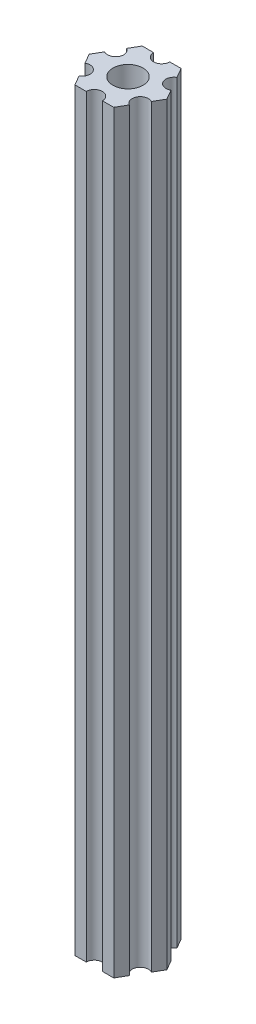
from build123d import *

# Parameters (mm, degrees)
ESBO_O1_R                = 2.79
RESSALTO_EXTRUS_O1_DEPTH = 140


with BuildPart() as part:
    # Esboço1 → Ressalto-extrusão1 (new body)
    with BuildSketch(Plane(origin=(0, 85, 0), x_dir=(1, 0, 0), z_dir=(0, 1, 0))):
        with BuildLine():
            Line((6.162658774, -1.825961894), (7.216878365, 0))
            Line((7.216878365, 0), (6.162658774, 1.825961894))
            ThreePointArc((6.162658774, 1.825961894), (4.113620668, 2.375), (4.662658774, 4.424038106))
            Line((4.662658774, 4.424038106), (3.608439182, 6.25))
            Line((3.608439182, 6.25), (1.5, 6.25))
            ThreePointArc((1.5, 6.25), (0, 4.75), (-1.5, 6.25))
            Line((-1.5, 6.25), (-3.608439182, 6.25))
            Line((-3.608439182, 6.25), (-4.662658774, 4.424038106))
            ThreePointArc((-4.662658774, 4.424038106), (-4.113620668, 2.375), (-6.162658774, 1.825961894))
            Line((-6.162658774, 1.825961894), (-7.216878365, 0))
            Line((-7.216878365, 0), (-6.162658774, -1.825961894))
            ThreePointArc((-6.162658774, -1.825961894), (-4.113620668, -2.375), (-4.662658774, -4.424038106))
            Line((-4.662658774, -4.424038106), (-3.608439182, -6.25))
            Line((-3.608439182, -6.25), (-1.5, -6.25))
            ThreePointArc((-1.5, -6.25), (0, -4.75), (1.5, -6.25))
            Line((1.5, -6.25), (3.608439182, -6.25))
            Line((3.608439182, -6.25), (4.662658774, -4.424038106))
            ThreePointArc((4.662658774, -4.424038106), (4.113620668, -2.375), (6.162658774, -1.825961894))
        make_face()
        Circle(ESBO_O1_R, mode=Mode.SUBTRACT)
    extrude(amount=-RESSALTO_EXTRUS_O1_DEPTH)


solid = part.part
